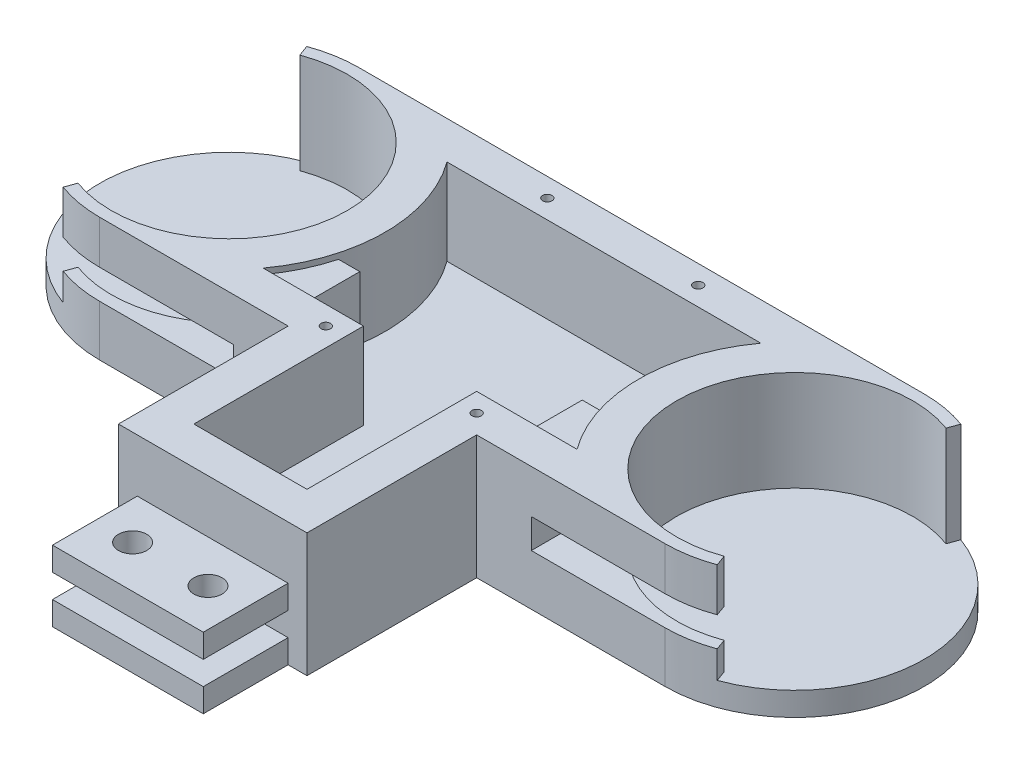
from build123d import *

# Parameters (mm, degrees)
BOSS_EXTRUDE1_DEPTH = 26.9875
BOSS_EXTRUDE5_START = -6.35
BOSS_EXTRUDE5_DEPTH = 6.35
SKETCH3_W           = 25.4
SKETCH3_H           = 33.3375
BOSS_EXTRUDE7_DEPTH = 45.72
SKETCH6_W           = 8.89
SKETCH6_H           = 33.3375
BOSS_EXTRUDE8_DEPTH = 22.86
SKETCH7_W           = 22.86
SKETCH7_H           = 14.5415
SKETCH7_H_2         = 6.604
CUT_EXTRUDE1_DEPTH  = 21.082
SKETCH11_W          = 51.2557102
SKETCH11_H          = 7.9375
CUT_EXTRUDE3_DEPTH  = 13.716
SHELL1_START        = 3.81
SHELL1_DEPTH        = 23.1775
SHELL1_START_2      = 25.4635
SHELL1_2_DEPTH      = 1.524
SKETCH13_R          = 1.26873
CUT_EXTRUDE4_DEPTH  = 35.56
SKETCH14_W          = 40.64
SKETCH14_H          = 6.35
BOSS_EXTRUDE9_DEPTH = 22.86
CUT_EXTRUDE5_REACH  = 156.884
SKETCH16_R          = 3.81


# Read off the part's stored shape, not the designer's step: Shell1
with BuildPart() as part:
    # Sketch1 → Boss-Extrude1 (new body)
    with BuildSketch(Plane(origin=(0, 0, 0), x_dir=(1, 0, 0), z_dir=(0, 1, 0))):
        with BuildLine():
            ThreePointArc((-27.606252307, 13.699523808), (-37.835547974, 38.395228141), (-62.531252307, 48.624523808))
            Line((-62.531252307, 48.624523808), (-62.531252307, 45.513023808))
            ThreePointArc((-62.531252307, 45.513023808), (-40.035710723, 36.195065391), (-30.717752307, 13.699523808))
            ThreePointArc((-30.717752307, 13.699523808), (-40.035710723, -8.796017775), (-62.531252307, -18.113976192))
            Line((-62.531252307, -18.113976192), (-62.531252307, -21.225476192))
            ThreePointArc((-62.531252307, -21.225476192), (-37.835547974, -10.996180525), (-27.606252307, 13.699523808))
        make_face()
        with BuildLine():
            Line((-62.531252307, 45.513023808), (-62.531252307, 48.624523808))
            ThreePointArc((-62.531252307, 48.624523808), (-68.595914912, 48.093934582), (-74.476305812, 46.518288589))
            Line((-74.476305812, 46.518288589), (-73.412110136, 43.594434999))
            ThreePointArc((-73.412110136, 43.594434999), (-68.055608607, 45.029705258), (-62.531252307, 45.513023808))
        make_face()
        with BuildLine():
            ThreePointArc((-74.476305812, -19.119240973), (-68.595914912, -20.694886966), (-62.531252307, -21.225476192))
            Line((-62.531252307, -21.225476192), (-62.531252307, -18.113976192))
            ThreePointArc((-62.531252307, -18.113976192), (-68.055608607, -17.630657643), (-73.412110136, -16.195387383))
            Line((-73.412110136, -16.195387383), (-74.476305812, -19.119240973))
        make_face()
        with BuildLine():
            Line((13.643756331, 48.624523808), (-62.531252307, 48.624523808))
            ThreePointArc((-62.531252307, 48.624523808), (-37.835547974, 38.395228141), (-27.606252307, 13.699523808))
            ThreePointArc((-27.606252307, 13.699523808), (-37.835547974, -10.996180525), (-62.531252307, -21.225476192))
            Line((-62.531252307, -21.225476192), (13.643756331, -21.225476192))
            Line((13.643756331, -21.225476192), (13.643756331, 48.624523808))
        make_face()
    boss_extrude1 = extrude(amount=BOSS_EXTRUDE1_DEPTH)

    # Sketch1<5> → Boss-Extrude5 (add)
    with BuildSketch(Plane(origin=(0, 0, 0), x_dir=(1, 0, 0), z_dir=(0, 1, 0)).offset(BOSS_EXTRUDE5_START)):
        with BuildLine():
            Line((-62.531252307, -21.225476192), (13.643756331, -21.225476192))
            Line((13.643756331, -21.225476192), (13.643756331, 48.624523808))
            Line((13.643756331, 48.624523808), (-62.531252307, 48.624523808))
            ThreePointArc((-62.531252307, 48.624523808), (-97.456252307, 13.699523808), (-62.531252307, -21.225476192))
        make_face()
    boss_extrude5 = extrude(amount=BOSS_EXTRUDE5_DEPTH)

    # Mirror1: Boss-Extrude1, Boss-Extrude5 across plane
    add(boss_extrude1.mirror(Plane(origin=(13.643756331, 26.9875, 0), x_dir=(0, 0, 1), z_dir=(1, 0, 0))))
    add(boss_extrude5.mirror(Plane(origin=(13.643756331, 26.9875, 0), x_dir=(0, 0, 1), z_dir=(1, 0, 0))))

    # Sketch3 → Boss-Extrude7 (add)
    with BuildSketch(Plane.XY.offset(21.225476192)):
        with Locations((0.943756331, 10.31875)):
            Rectangle(SKETCH3_W, SKETCH3_H)
        with Locations((26.343756331, 10.31875)):
            Rectangle(SKETCH3_W, SKETCH3_H)
    extrude(amount=BOSS_EXTRUDE7_DEPTH)

    # Sketch6 → Boss-Extrude8 (add)
    with BuildSketch(Plane.XY.offset(66.945476192)):
        with Locations((9.198756331, 10.31875)):
            Rectangle(SKETCH6_W, SKETCH6_H)
        with Locations((18.088756331, 10.31875)):
            Rectangle(SKETCH6_W, SKETCH6_H)
    extrude(amount=BOSS_EXTRUDE8_DEPTH)

    # Sketch7 → Cut-Extrude1 (cut)
    with BuildSketch(Plane.ZY.offset(-4.753756331)):
        with Locations((78.375476192, 19.71675)):
            Rectangle(SKETCH7_W, SKETCH7_H)
        with Locations((78.375476192, 3.048)):
            Rectangle(SKETCH7_W, SKETCH7_H_2)
    extrude(amount=-CUT_EXTRUDE1_DEPTH, mode=Mode.SUBTRACT)

    # Sketch11 → Cut-Extrude3 (cut)
    with BuildSketch(Plane.XY.offset(21.225476192)):
        with Locations((-52.116098769, 11.33475)):
            Rectangle(SKETCH11_W, SKETCH11_H)
    cut_extrude3 = extrude(amount=-CUT_EXTRUDE3_DEPTH, mode=Mode.SUBTRACT)

    # Mirror2: Cut-Extrude3 across plane
    add(cut_extrude3.mirror(Plane(origin=(13.64376748, 0, 0), x_dir=(0, 0, 1), z_dir=(1, 0, 0))), mode=Mode.SUBTRACT)

    # Shell1 outline → Shell1 (cut)
    with BuildSketch(Plane(origin=(0, 0, 0), x_dir=(1, 0, 0), z_dir=(0, 1, 0)).offset(SHELL1_START)):
        with BuildLine():
            Line((-16.328243669, 2.650523808), (-16.328243669, -11.065476192))
            Line((-16.328243669, -11.065476192), (-1.596243669, -11.065476192))
            Line((-1.596243669, -11.065476192), (-1.596243669, -56.785476192))
            Line((-1.596243669, -56.785476192), (28.883756331, -56.785476192))
            Line((28.883756331, -56.785476192), (28.883756331, -11.065476192))
            Line((28.883756331, -11.065476192), (43.615778629, -11.065476192))
            Line((43.615778629, -11.065476192), (43.615778629, 2.650523808))
            Line((43.615778629, 2.650523808), (49.325626028, 2.650523808))
            ThreePointArc((49.325626028, 2.650523808), (48.541178718, 21.311066068), (55.929688893, 38.464523808))
            Line((55.929688893, 38.464523808), (-28.642176231, 38.464523808))
            ThreePointArc((-28.642176231, 38.464523808), (-21.253666056, 21.311066068), (-22.038113366, 2.650523808))
            Line((-22.038113366, 2.650523808), (-16.328243669, 2.650523808))
        make_face()
    extrude(amount=SHELL1_DEPTH, mode=Mode.SUBTRACT)

    # Shell1 2 outline → Shell1 2 (cut)
    with BuildSketch(Plane(origin=(0, 0, 0), x_dir=(1, 0, 0), z_dir=(0, 1, 0)).offset(SHELL1_START_2)):
        with BuildLine():
            ThreePointArc((-22.038113366, 2.650523808), (-24.713126472, -4.509376779), (-28.642176231, -11.065476192))
            Line((-28.642176231, -11.065476192), (-16.328243669, -11.065476192))
            Line((-16.328243669, -11.065476192), (-16.328243669, 2.650523808))
            Line((-16.328243669, 2.650523808), (-22.038113366, 2.650523808))
        make_face()
        with BuildLine():
            ThreePointArc((55.929688893, -11.065476192), (52.000639133, -4.509376779), (49.325626028, 2.650523808))
            Line((49.325626028, 2.650523808), (43.615778629, 2.650523808))
            Line((43.615778629, 2.650523808), (43.615778629, -11.065476192))
            Line((43.615778629, -11.065476192), (55.929688893, -11.065476192))
        make_face()
    extrude(amount=SHELL1_2_DEPTH, mode=Mode.SUBTRACT)

    # Sketch13 → Cut-Extrude4 (cut)
    with BuildSketch(Plane(origin=(0, 26.9875, 0), x_dir=(1, 0, 0), z_dir=(0, 1, 0))):
        with Locations(Location((33.963756331, -16.145476192, 0), (0, 0, 270))):
            Circle(SKETCH13_R)
        with Locations(Location((-6.676243669, -16.145476192, 0), (0, 0, 270))):
            Circle(SKETCH13_R)
        with Locations(Location((-6.676243669, 43.544523808, 0), (0, 0, 270))):
            Circle(SKETCH13_R)
        with Locations(Location((33.963756331, 43.544523808, 0), (0, 0, 270))):
            Circle(SKETCH13_R)
    extrude(amount=-CUT_EXTRUDE4_DEPTH, mode=Mode.SUBTRACT)

    # Sketch14 → Boss-Extrude9 (add)
    with BuildSketch(Plane.XY.offset(66.945476192)):
        with Locations((13.64376748, 9.525)):
            Rectangle(SKETCH14_W, SKETCH14_H)
        with Locations((13.64376748, -3.175)):
            Rectangle(SKETCH14_W, SKETCH14_H)
    extrude(amount=BOSS_EXTRUDE9_DEPTH)

    # Cut-Extrude5: up to this face of the body (flat: up to its plane)
    cut_extrude5_end = Plane(part.part.faces().sort_by_distance((13.643756916, -6.35, -1.287747725))[0])
    # Sketch16 → Cut-Extrude5 (cut, up to the picked face)
    with BuildSketch(Plane(origin=(0, 12.7, 0), x_dir=(1, 0, 0), z_dir=(0, 1, 0)), mode=Mode.PRIVATE) as cut_extrude5_sk1:
        with Locations(Location((3.48376748, -78.375476192, 0), (0, 0, 270))):
            Circle(SKETCH16_R)
    cut_extrude5_tool1 = split(extrude(cut_extrude5_sk1.sketch, amount=-CUT_EXTRUDE5_REACH, mode=Mode.PRIVATE), bisect_by=cut_extrude5_end, keep=Keep.BOTH, mode=Mode.PRIVATE)
    cut_extrude5 = cut_extrude5_tool1.solids().sort_by(Axis((3.483767, 12.7, 78.375476), (0, -1, 0)))[0]
    add(cut_extrude5, mode=Mode.SUBTRACT)

    # Mirror3: Cut-Extrude5 across plane
    add(cut_extrude5.mirror(Plane(origin=(13.64376748, 0, 0), x_dir=(0, 0, 1), z_dir=(1, 0, 0))), mode=Mode.SUBTRACT)


solid = part.part
